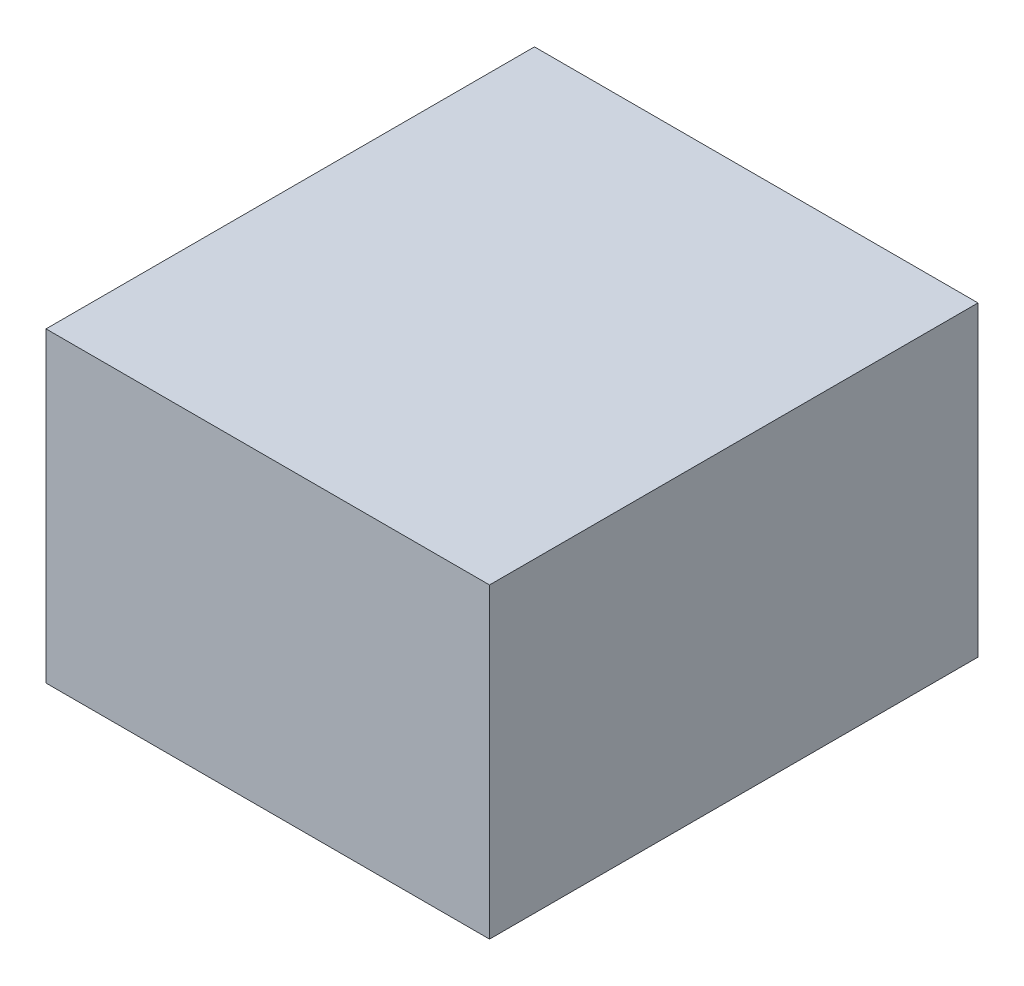
from build123d import *

# Parameters (mm, degrees)
SKETCH1_W           = 90.8
SKETCH1_H           = 100
BOSS_EXTRUDE1_DEPTH = 62.8
CUT_EXTRUDE2_DEPTH  = 50
SKETCH3_R           = 3.25
BOSS_EXTRUDE2_DEPTH = 1.8
FILLET3_R           = 1.8
SKETCH4_R           = 2.25
BOSS_EXTRUDE3_DEPTH = 0.5
SKETCH6_R           = 6.75
BOSS_EXTRUDE4_DEPTH = 2.2
CHAMFER2_SIZE       = 1.4


with BuildPart() as part:
    # Sketch1 → Boss-Extrude1 (new body)
    with BuildSketch(Plane(origin=(0, 0, 0), x_dir=(1, 0, 0), z_dir=(0, 1, 0))):
        Rectangle(SKETCH1_W, SKETCH1_H)
    extrude(amount=BOSS_EXTRUDE1_DEPTH)

    # Sketch2 → Cut-Extrude2 (cut)
    with BuildSketch(Plane(origin=(0, 0, 0), x_dir=(-1, 0, 0), z_dir=(0, -1, 0))):
        with BuildLine():
            Line((33.550736089, -1.55), (33.550736089, -5.448527997))
            ThreePointArc((33.550736089, -5.448527997), (31.999263911, -7.000000175), (30.447791734, -5.448527997))
            Line((30.447791734, -5.448527997), (30.447791734, -1.55))
            Line((30.447791734, -1.55), (26.55, -1.55))
            ThreePointArc((26.55, -1.55), (25, 0), (26.55, 1.55))
            Line((26.55, 1.55), (30.447791734, 1.55))
            Line((30.447791734, 1.55), (30.447791734, 5.448527997))
            ThreePointArc((30.447791734, 5.448527997), (31.999263911, 7.000000175), (33.550736089, 5.448527997))
            Line((33.550736089, 5.448527997), (33.550736089, 1.55))
            Line((33.550736089, 1.55), (37.45, 1.55))
            ThreePointArc((37.45, 1.55), (39, 0), (37.45, -1.55))
            Line((37.45, -1.55), (33.550736089, -1.55))
        make_face()
        with BuildLine():
            Line((-30.447791734, 1.55), (-30.447791734, 5.448527997))
            ThreePointArc((-30.447791734, 5.448527997), (-31.999263911, 7.000000175), (-33.550736089, 5.448527997))
            Line((-33.550736089, 5.448527997), (-33.550736089, 1.55))
            Line((-33.550736089, 1.55), (-37.45, 1.55))
            ThreePointArc((-37.45, 1.55), (-39, 0), (-37.45, -1.55))
            Line((-37.45, -1.55), (-33.550736089, -1.55))
            Line((-33.550736089, -1.55), (-33.550736089, -5.448527997))
            ThreePointArc((-33.550736089, -5.448527997), (-31.999263911, -7.000000175), (-30.447791734, -5.448527997))
            Line((-30.447791734, -5.448527997), (-30.447791734, -1.55))
            Line((-30.447791734, -1.55), (-26.55, -1.55))
            ThreePointArc((-26.55, -1.55), (-25, 0), (-26.55, 1.55))
            Line((-26.55, 1.55), (-30.447791734, 1.55))
        make_face()
    extrude(amount=-CUT_EXTRUDE2_DEPTH, mode=Mode.SUBTRACT)

    # Sketch3 → Boss-Extrude2 (add)
    with BuildSketch(Plane.XZ):
        with Locations(Location((31.999263911, 35.350000175, 0), (0, 0, 270))):
            Circle(SKETCH3_R)
        with Locations(Location((31.999263911, -35.350000175, 0), (0, 0, 270))):
            Circle(SKETCH3_R)
        with Locations(Location((-31.999263911, -35.350000175, 0), (0, 0, 90))):
            Circle(SKETCH3_R)
        with Locations(Location((-31.999263911, 35.350000175, 0), (0, 0, 90))):
            Circle(SKETCH3_R)
    extrude(amount=BOSS_EXTRUDE2_DEPTH)

    # Fillet3
    fillet3_edges = [part.edges().sort_by_distance(p)[0] for p in [
        (-31.999263911, -1.8, 32.100000175),
        (31.999263911, -1.8, -32.100000175),
        (31.999263911, -1.8, 38.600000175),
        (-31.999263911, -1.8, -38.600000175),
    ]]
    fillet(fillet3_edges, radius=FILLET3_R - 0.0001)  # a hair under: the kernel refuses the full size

    # Sketch4 → Boss-Extrude3 (add)
    with BuildSketch(Plane(origin=(0, 0, 0), x_dir=(-1, 0, 0), z_dir=(0, -1, 0))):
        with Locations(Location((18.65, -44.25, 0), (0, 0, 90))):
            Circle(SKETCH4_R)
        with Locations(Location((-39.15, -44.25, 0), (0, 0, 90))):
            Circle(SKETCH4_R)
        with Locations(Location((-39.15, 44.25, 0), (0, 0, 270))):
            Circle(SKETCH4_R)
        with Locations(Location((18.65, 44.25, 0), (0, 0, 270))):
            Circle(SKETCH4_R)
    extrude(amount=BOSS_EXTRUDE3_DEPTH)

    # Sketch6 → Boss-Extrude4 (add)
    with BuildSketch(Plane.ZY.offset(45.4)):
        with Locations(Location((24.75, 49.55, 0), (0, 0, 180))):
            Circle(SKETCH6_R)
    extrude(amount=BOSS_EXTRUDE4_DEPTH)

    # Chamfer2
    chamfer2_edges = [part.edges().sort_by_distance(p)[0] for p in [
        (-47.6, 49.55, 31.5),
    ]]
    chamfer(chamfer2_edges, length=CHAMFER2_SIZE)


solid = part.part
